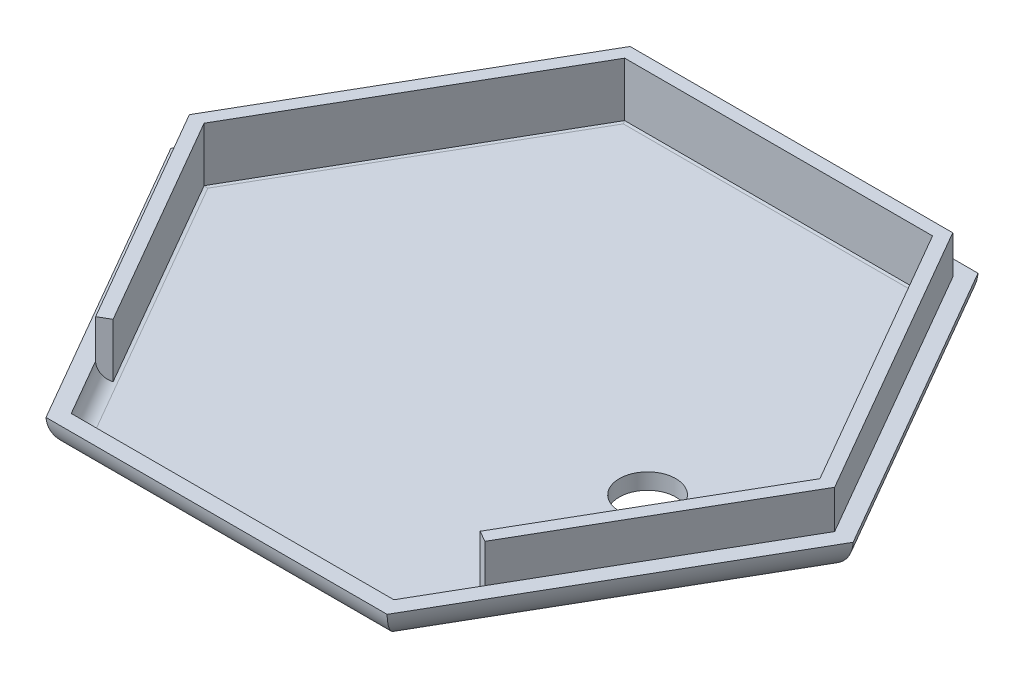
from build123d import *

# Parameters (mm, degrees)
BOSS_EXTRUDE1_DEPTH             = 1.5875
BOSS_EXTRUDE2_DEPTH             = 1.5875
FILLET2_R                       = 1.5875
FILLET3_R                       = 3.302
BOSS_EXTRUDE3_DEPTH             = 3.81
BOSS_EXTRUDE3_DIRECTION_2_REACH = 49.633
SKETCH5_R                       = 2.797863207
CUT_EXTRUDE1_DEPTH              = 3.81


# Some blends are built 0.0001 mm under size
with BuildPart() as part:
    # Sketch1 → Boss-Extrude1 (new body)
    with BuildSketch(Plane(origin=(0, 0, 0), x_dir=(1, 0, 0), z_dir=(0, 1, 0))):
        Polygon((-34.41906837, 3.470841979), (-17.500524818, -25.832935043), (16.336562287, -25.832935043), (33.255105839, 3.470841979), (16.336562287, 32.774619002), (-17.500524818, 32.774619002), align=None)
    extrude(amount=BOSS_EXTRUDE1_DEPTH)

    # Sketch2 → Boss-Extrude2 (add)
    # profile 1 of 3: a face of its own
    with BuildSketch(Plane(origin=(0, 1.5875, 0), x_dir=(1, 0, 0), z_dir=(0, 1, 0))):
        Polygon((16.336562287, 32.774619002), (-17.500524818, 32.774619002), (-34.41906837, 3.470841979), (-17.500524818, -25.832935043), (16.336562287, -25.832935043), (33.255105839, 3.470841979), align=None)
        Polygon((-32.585981265, 3.470841979), (-16.583981265, 31.187119002), (15.420018735, 31.187119002), (31.422018735, 3.470841979), (15.420018735, -24.245435043), (-16.583981265, -24.245435043), align=None, mode=Mode.SUBTRACT)
    # profile 2 of 3: a face of its own
    with BuildSketch(Plane(origin=(0, 1.5875, 0), x_dir=(1, 0, 0), z_dir=(0, 1, 0))):
        Polygon((16.336562287, 32.774619002), (-17.500524818, 32.774619002), (-34.41906837, 3.470841979), (-17.500524818, -25.832935043), (16.336562287, -25.832935043), (33.255105839, 3.470841979), align=None)
        Polygon((-32.585981265, 3.470841979), (-16.583981265, 31.187119002), (15.420018735, 31.187119002), (31.422018735, 3.470841979), (15.420018735, -24.245435043), (-16.583981265, -24.245435043), align=None, mode=Mode.SUBTRACT)
    # profile 3 of 3: a face of its own
    with BuildSketch(Plane(origin=(0, 1.5875, 0), x_dir=(1, 0, 0), z_dir=(0, 1, 0))):
        Polygon((33.255105839, 3.470841979), (16.336562287, 32.774619002), (-17.500524818, 32.774619002), (-34.41906837, 3.470841979), (-17.500524818, -25.832935043), (16.336562287, -25.832935043), align=None)
        Polygon((-16.583981265, -24.245435043), (-32.585981265, 3.470841979), (-16.583981265, 31.187119002), (15.420018735, 31.187119002), (31.422018735, 3.470841979), (15.420018735, -24.245435043), align=None, mode=Mode.SUBTRACT)
    extrude(amount=BOSS_EXTRUDE2_DEPTH)

    # Fillet2
    fillet2_edges = [part.edges().sort_by_distance(p)[0] for p in [
        (23.421018735, 1.5875, -17.328980491),
        (23.421018735, 1.5875, 10.387296532),
        (-24.584981265, 1.5875, -17.328980491),
        (-0.581981265, 1.5875, 24.245435043),
        (-24.584981265, 1.5875, 10.387296532),
        (-0.581981265, 1.5875, -31.187119002),
    ]]
    fillet(fillet2_edges, radius=FILLET2_R - 0.0001)  # a hair under: the kernel refuses the full size

    # Fillet3
    # the kernel refuses this fillet: 3.302 mm, written as the material it takes off along each edge
    with BuildSketch(Plane(origin=(-25.749416789, 0, 25.832935043), x_dir=(0, 1, 0), z_dir=(1, 0, 0)), Plane(origin=(-38.543514355, 0, -10.614591979), x_dir=(0, 1, 0), z_dir=(0.4999999999999999, 0, 0.8660254037844387)), Plane(origin=(-13.376078832, 0, -39.918369002), x_dir=(0, 1, 0), z_dir=(-0.5000000000000002, 0, 0.8660254037844386)), Plane(origin=(24.585454258, 0, -32.774619002), x_dir=(0, 1, 0), z_dir=(-1, 0, 0)), Plane(origin=(12.212116302, 0, 32.976685043), x_dir=(0, 1, 0), z_dir=(0.5000000000000001, 0, -0.8660254037844387)), Plane(origin=(37.379551825, 0, 3.672908021), x_dir=(0, 1, 0), z_dir=(-0.5, 0, -0.8660254037844387))) as fillet3_piece_1:
        with BuildLine():
            CenterArc((3.302, -3.299556788), FILLET3_R, 92.204227504, 87.795772496)
            Line((0, -3.299556788), (-0.06604, -3.299556788))
            Line((-0.06604, -3.299556788), (-0.06604, 0))
            Line((-0.06604, 0), (0, 0.06604))
            ThreePointArc((0, 0.06604), (1.5875, 0.06604), (3.17246, 0.065991136))
            Line((3.17246, 0.065991136), (3.175, 0))
        make_face()
    extrude(amount=50.334871047, mode=Mode.SUBTRACT)

    # Sketch4 → Boss-Extrude3 (add)
    with BuildSketch(Plane(origin=(0, 3.175, 0), x_dir=(1, 0, 0), z_dir=(0, 1, 0))):
        Polygon((-32.585981265, 3.470841979), (-16.583981265, 31.187119002), (15.420018735, 31.187119002), (31.422018735, 3.470841979), (18.722018735, -18.526203277), (17.622166472, -17.891203277), (29.955549051, 3.470841979), (14.686783893, 29.917119002), (-15.850746423, 29.917119002), (-31.119511582, 3.470841979), (-18.786129002, -17.891203277), (-19.885981265, -18.526203277), align=None)
    extrude(amount=BOSS_EXTRUDE3_DEPTH)

    # Sketch4 → Boss-Extrude3 direction 2 (add, up to next)
    with BuildSketch(Plane(origin=(0, 3.175, 0), x_dir=(1, 0, 0), z_dir=(0, 1, 0)), mode=Mode.PRIVATE) as boss_extrude3_direction_2_sk1:
        Polygon((-32.585981265, 3.470841979), (-16.583981265, 31.187119002), (15.420018735, 31.187119002), (31.422018735, 3.470841979), (18.722018735, -18.526203277), (17.622166472, -17.891203277), (29.955549051, 3.470841979), (14.686783893, 29.917119002), (-15.850746423, 29.917119002), (-31.119511582, 3.470841979), (-18.786129002, -17.891203277), (-19.885981265, -18.526203277), align=None)
    boss_extrude3_direction_2_tool1 = extrude(boss_extrude3_direction_2_sk1.sketch, amount=-BOSS_EXTRUDE3_DIRECTION_2_REACH, mode=Mode.PRIVATE) - part.part
    add(boss_extrude3_direction_2_tool1.solids().sort_by_distance((-23.883103, 3.175, -16.923751))[0])

    # Sketch5 → Cut-Extrude1 (cut)
    with BuildSketch(Plane(origin=(0, 1.5875, 0), x_dir=(1, 0, 0), z_dir=(0, 1, 0))):
        with Locations(Location((17.401743672, -1.065074689, 0), (0, 0, 270))):
            Circle(SKETCH5_R)
    extrude(amount=-CUT_EXTRUDE1_DEPTH, mode=Mode.SUBTRACT)


solid = part.part
